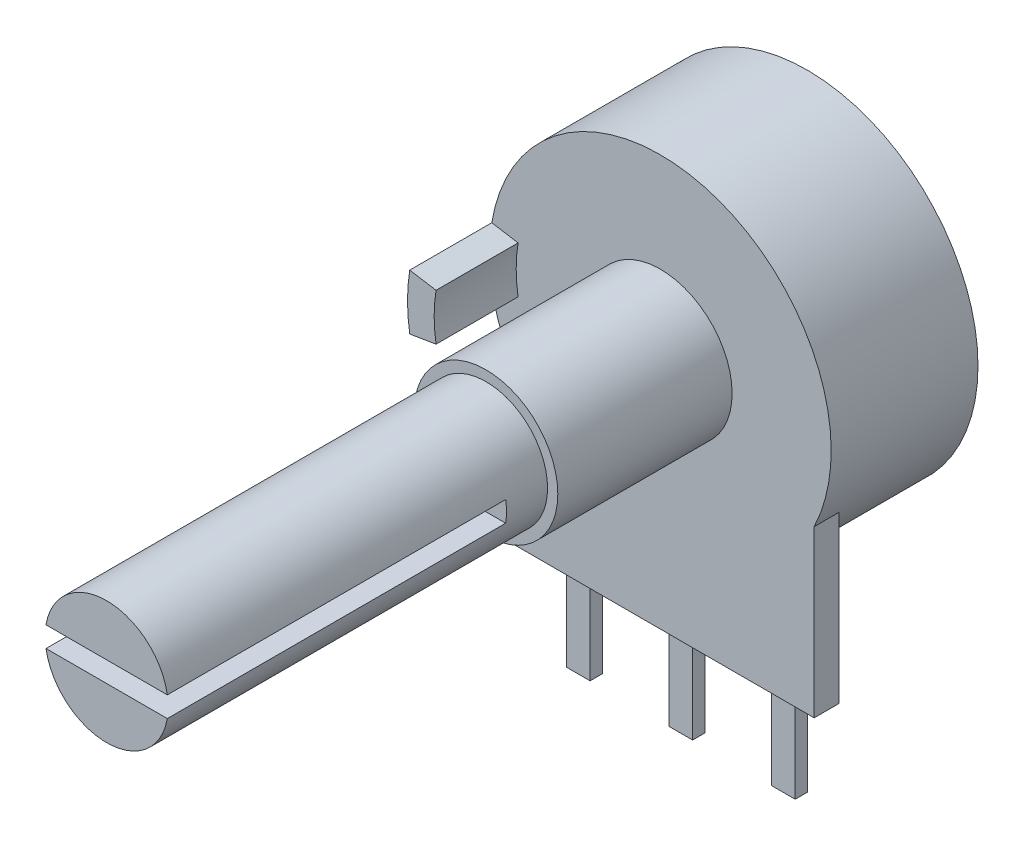
from build123d import *
from build123d.topology import SkipClean

# Parameters (mm, degrees)
SKETCH1_R           = 8.33
BOSS_EXTRUDE1_DEPTH = 7.16
SKETCH2_R           = 3.5
BOSS_EXTRUDE2_DEPTH = 8.5
BOSS_EXTRUDE6_START = -8.5
SKETCH6_R           = 3
BOSS_EXTRUDE6_DEPTH = 27
SKETCH7_W           = 6
SKETCH7_H           = 1
CUT_EXTRUDE1_DEPTH  = 16.5
SKETCH3_W           = 15
SKETCH3_H           = 11.20454244
BOSS_EXTRUDE3_DEPTH = 1.2
BOSS_EXTRUDE4_START = -0.2
SKETCH4_W           = 1.15
SKETCH4_H           = 4.9
BOSS_EXTRUDE4_DEPTH = 0.6
LPATTERN1_COUNT     = 2
LPATTERN1_PITCH     = 5
LPATTERN1_COL_COUNT = 2
LPATTERN1_COL_PITCH = 5
BOSS_EXTRUDE5_DEPTH = 4


with BuildPart() as part:
    # Sketch1 → Boss-Extrude1 (new body)
    with BuildSketch(Plane.XY):
        with Locations(Location((0, 0, 0), (0, 0, 180))):
            Circle(SKETCH1_R)
    extrude(amount=BOSS_EXTRUDE1_DEPTH)

    # Sketch2 → Boss-Extrude2 (add)
    with BuildSketch(Plane.XY.offset(7.16)):
        Circle(SKETCH2_R)
    extrude(amount=BOSS_EXTRUDE2_DEPTH)

    # Sketch6 → Boss-Extrude6 (add)
    with BuildSketch(Plane.XY.offset(15.66).offset(BOSS_EXTRUDE6_START)):
        Circle(SKETCH6_R)
    extrude(amount=BOSS_EXTRUDE6_DEPTH)

    # Sketch7 → Cut-Extrude1 (cut)
    with BuildSketch(Plane.XY.offset(34.16)):
        Rectangle(SKETCH7_W, SKETCH7_H)
    extrude(amount=-CUT_EXTRUDE1_DEPTH, mode=Mode.SUBTRACT)

    # Sketch3 → Boss-Extrude3 (add)
    with BuildSketch(Plane.XY.offset(7.16)):
        with Locations((0, -6.09772878)):
            Rectangle(SKETCH3_W, SKETCH3_H)
    extrude(amount=-BOSS_EXTRUDE3_DEPTH)

    # Sketch4 → Boss-Extrude4 (add)
    with BuildSketch(Plane(origin=(0, 0, 5.96), x_dir=(-1, 0, 0), z_dir=(0, 0, -1)).offset(BOSS_EXTRUDE4_START)):
        with Locations((0, -14.15)):
            Rectangle(SKETCH4_W, SKETCH4_H)
    boss_extrude4 = extrude(amount=BOSS_EXTRUDE4_DEPTH)

    # LPattern1: Boss-Extrude4 ×2
    with Locations(*[(i * LPATTERN1_PITCH, 0, 0) for i in range(1, LPATTERN1_COUNT)]):
        add(boss_extrude4)

    # LPattern1 col: Boss-Extrude4 ×2
    with Locations(*[(-i * LPATTERN1_COL_PITCH, 0, 0) for i in range(1, LPATTERN1_COL_COUNT)]):
        add(boss_extrude4)

    # Sketch5 → Boss-Extrude5 (add)
    with SkipClean():  # the faces are left unmerged after this step: merging them gives an invalid solid
        with BuildSketch(Plane.XY.offset(7.16)):
            with BuildLine():
                Line((-8.219878345, 1.35), (-6.937064197, 1.139315726))
                ThreePointArc((-6.937064197, 1.139315726), (-7.03, 0), (-6.937064197, -1.139315726))
                Line((-6.937064197, -1.139315726), (-8.219878345, -1.35))
                ThreePointArc((-8.219878345, -1.35), (-8.33, 0), (-8.219878345, 1.35))
            make_face()
        extrude(amount=BOSS_EXTRUDE5_DEPTH)
    add(part.part.scale(1), mode=Mode.REPLACE)  # the faces are merged on a copy


solid = part.part
